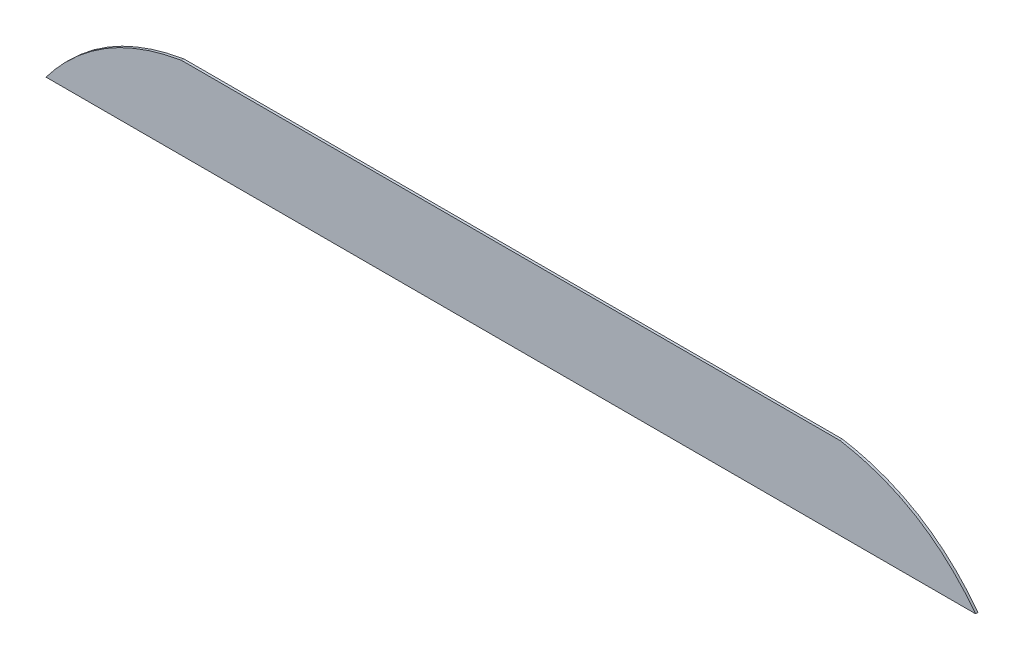
from build123d import *

# Parameters (mm, degrees)
BOSS_EXTRUDE1_DEPTH = 3.175


with BuildPart() as part:
    # Sketch1 → Boss-Extrude1 (new body)
    with BuildSketch(Plane.XY):
        with BuildLine():
            Line((0, 0), (-304.8, 0))
            add(Edge.make_bspline(
                [(-304.8, 0), (-237.055819488, 89.508518708), (-127, 107.95)],
                knots=[0, 0, 0, 1, 1, 1], degree=2))
            Line((-127, 107.95), (0, 107.95))
            Line((0, 107.95), (609.6, 107.95))
            Line((609.6, 107.95), (736.6, 107.95))
            add(Edge.make_bspline(
                [(914.4, 0), (846.655819488, 89.508518708), (736.6, 107.95)],
                knots=[0, 0, 0, 1, 1, 1], degree=2))
            Line((914.4, 0), (609.6, 0))
            Line((609.6, 0), (0, 0))
        make_face()
    extrude(amount=BOSS_EXTRUDE1_DEPTH)


solid = part.part
